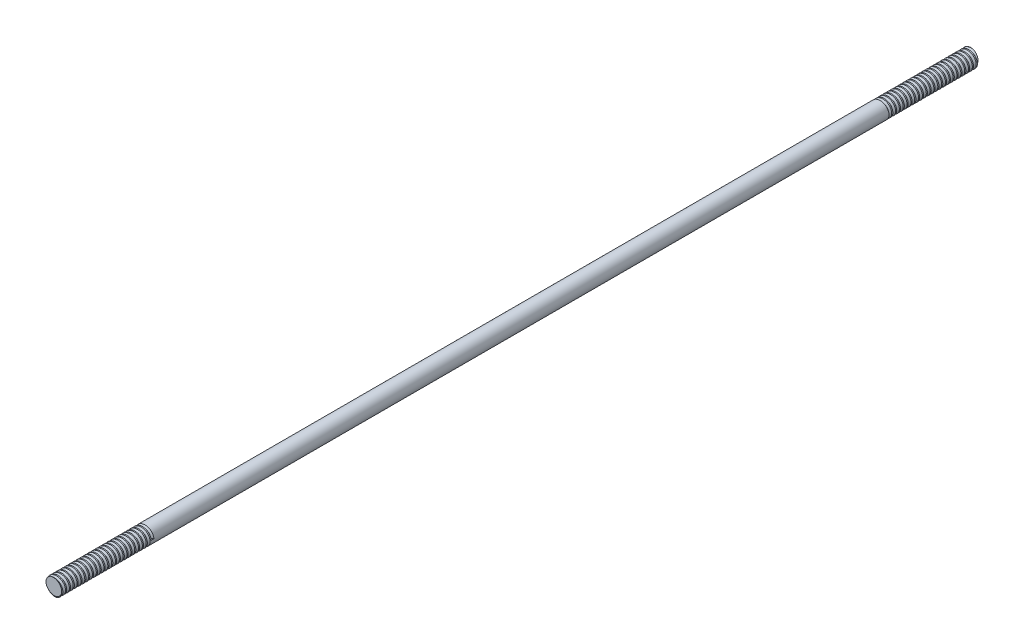
from build123d import *

# Parameters (mm, degrees)
SKETCH1_R      = 1.7526
ROD_DEPTH      = 189.593484
THREAD_1_PITCH = 0.79375
THREAD_2_PITCH = 0.79375


with BuildPart() as part:
    # Sketch1 → Rod (new body)
    with BuildSketch(Plane.XY):
        Circle(SKETCH1_R)
    extrude(amount=ROD_DEPTH)

    # Thread 1: the profile of Sketch4 profile screwed along a right-hand helix of 24 turns, 8 arcs to a turn; built about Z, then put on its axis
    thread_1_z = Axis((0, 0, 0), (0, 0, 1))
    thread_1_corners = [(1.7529, 0, 0.000173205), (1.7529, 0, -0.555798205), (1.340155401, 0, -0.3175), (1.340155401, 0, -0.238125)]
    with BuildLine(mode=Mode.PRIVATE) as thread_1_profile:
        Line(thread_1_corners[0], thread_1_corners[1])
        Line(thread_1_corners[1], thread_1_corners[2])
        Line(thread_1_corners[2], thread_1_corners[3])
        Line(thread_1_corners[3], thread_1_corners[0])
    thread_1_cap = Face(thread_1_profile.wire())
    thread_1_turn_angles = [0, 22.5, 45, 67.5, 90, 112.5, 135, 157.5, 180, 202.5, 225, 247.5, 270, 292.5, 315, 337.5, 360]
    thread_1_turn_weights = [1, 0.9238795325112867, 1, 0.9238795325112867, 1, 0.9238795325112867, 1, 0.9238795325112867, 1, 0.9238795325112867, 1, 0.9238795325112867, 1, 0.9238795325112867, 1, 0.9238795325112867, 1]
    thread_1_turn_rails = [Edge.make_bspline([Vector(p[0], p[1], 0).rotate(thread_1_z, thread_1_turn_angles[k]) / thread_1_turn_weights[k] + Vector(0, 0, p[2] + THREAD_1_PITCH * thread_1_turn_angles[k] / 360) for k in range(17)], [0, 0, 0, 1, 1, 2, 2, 3, 3, 4, 4, 5, 5, 6, 6, 7, 7, 8, 8, 8], 2, thread_1_turn_weights) for p in thread_1_corners]
    thread_1_turn_sides = [Face.make_surface_from_curves(thread_1_turn_rails[p[0]], thread_1_turn_rails[p[1]]) for p in [(0, 1), (1, 2), (2, 3), (3, 0)]]
    thread_1 = Plane(origin=(0, 0, 0), x_dir=(-1, 0, 0), z_dir=(0, 0, 1)) * Solid(Shell([*[p.moved(Location((0, 0, THREAD_1_PITCH * i))) for i in range(24) for p in thread_1_turn_sides], thread_1_cap, thread_1_cap.rotate(thread_1_z, 8640).moved(Location((0, 0, THREAD_1_PITCH * 8640 / 360)))]))
    add(thread_1, mode=Mode.SUBTRACT)

    # Thread 2: the profile of Sketch6 profile screwed along a right-hand helix of 24 turns, 8 arcs to a turn; built about Z, then put on its axis
    thread_2_z = Axis((0, 0, 0), (0, 0, 1))
    thread_2_corners = [(1.7529, 0, 0.000173205), (1.7529, 0, -0.555798205), (1.340155401, 0, -0.3175), (1.340155401, 0, -0.238125)]
    with BuildLine(mode=Mode.PRIVATE) as thread_2_profile:
        Line(thread_2_corners[0], thread_2_corners[1])
        Line(thread_2_corners[1], thread_2_corners[2])
        Line(thread_2_corners[2], thread_2_corners[3])
        Line(thread_2_corners[3], thread_2_corners[0])
    thread_2_cap = Face(thread_2_profile.wire())
    thread_2_turn_angles = [0, 22.5, 45, 67.5, 90, 112.5, 135, 157.5, 180, 202.5, 225, 247.5, 270, 292.5, 315, 337.5, 360]
    thread_2_turn_weights = [1, 0.9238795325112867, 1, 0.9238795325112867, 1, 0.9238795325112867, 1, 0.9238795325112867, 1, 0.9238795325112867, 1, 0.9238795325112867, 1, 0.9238795325112867, 1, 0.9238795325112867, 1]
    thread_2_turn_rails = [Edge.make_bspline([Vector(p[0], p[1], 0).rotate(thread_2_z, thread_2_turn_angles[k]) / thread_2_turn_weights[k] + Vector(0, 0, p[2] + THREAD_2_PITCH * thread_2_turn_angles[k] / 360) for k in range(17)], [0, 0, 0, 1, 1, 2, 2, 3, 3, 4, 4, 5, 5, 6, 6, 7, 7, 8, 8, 8], 2, thread_2_turn_weights) for p in thread_2_corners]
    thread_2_turn_sides = [Face.make_surface_from_curves(thread_2_turn_rails[p[0]], thread_2_turn_rails[p[1]]) for p in [(0, 1), (1, 2), (2, 3), (3, 0)]]
    thread_2 = Plane(origin=(0, 0, 189.593484), x_dir=(1, 0, 0), z_dir=(0, 0, -1)) * Solid(Shell([*[p.moved(Location((0, 0, THREAD_2_PITCH * i))) for i in range(24) for p in thread_2_turn_sides], thread_2_cap, thread_2_cap.rotate(thread_2_z, 8640).moved(Location((0, 0, THREAD_2_PITCH * 8640 / 360)))]))
    add(thread_2, mode=Mode.SUBTRACT)


solid = part.part
